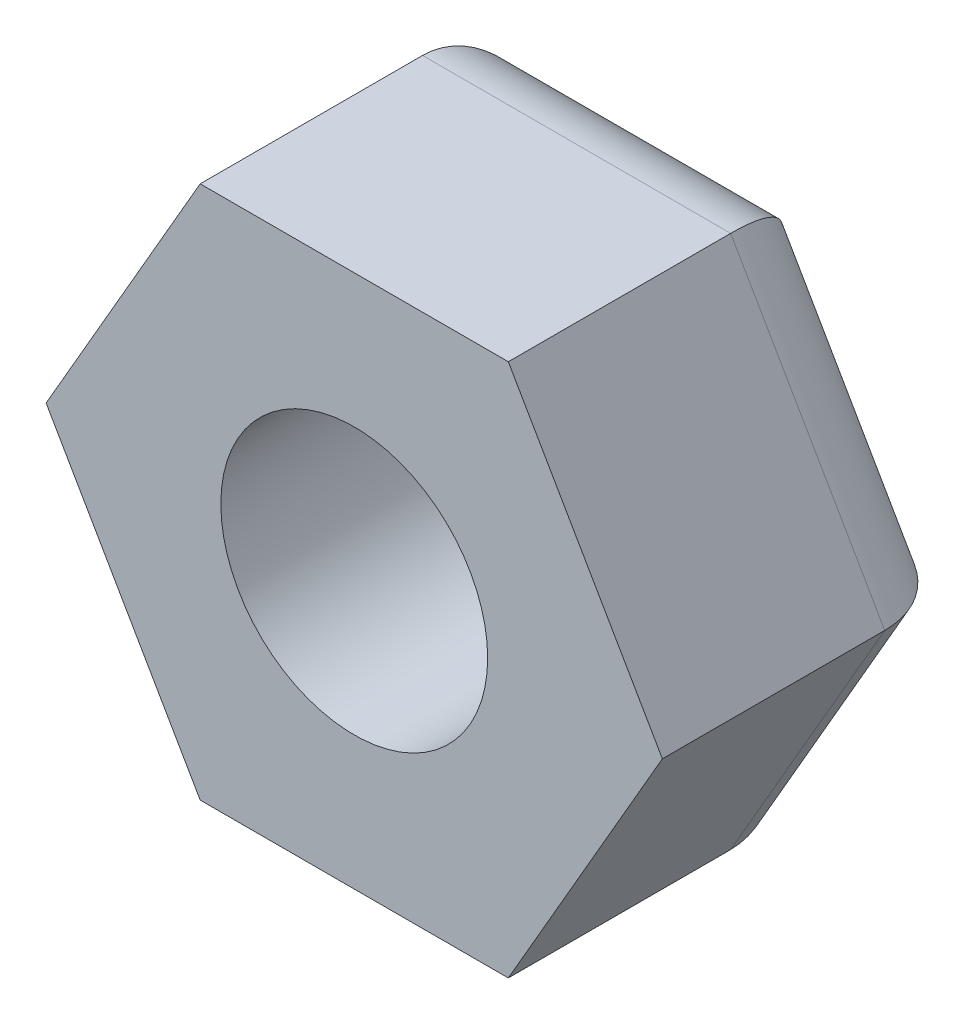
from build123d import *

# Parameters (mm, degrees)
SKETCH1_R           = 15
BOSS_EXTRUDE1_DEPTH = 35
FILLET3_R           = 10


with BuildPart() as part:
    # Sketch1 → Boss-Extrude1 (new body)
    with BuildSketch(Plane.XY):
        Polygon((-76.017992264, 37.336477303), (-58.697484189, 7.336477303), (-24.056468037, 7.336477303), (-6.735959962, 37.336477303), (-24.056468037, 67.336477303), (-58.697484189, 67.336477303), align=None)
        with Locations((-41.376976113, 37.336477303)):
            Circle(SKETCH1_R, mode=Mode.SUBTRACT)
    extrude(amount=BOSS_EXTRUDE1_DEPTH)

    # Fillet3
    fillet3_edges = [part.edges().sort_by_distance(p)[0] for p in [
        (-41.376976113, 7.336477303, 0),
        (-67.357738227, 22.336477303, 0),
        (-15.396214, 22.336477303, 0),
        (-15.396214, 52.336477303, 0),
        (-41.376976113, 67.336477303, 0),
        (-67.357738227, 52.336477303, 0),
    ]]
    fillet(fillet3_edges, radius=FILLET3_R)


solid = part.part
